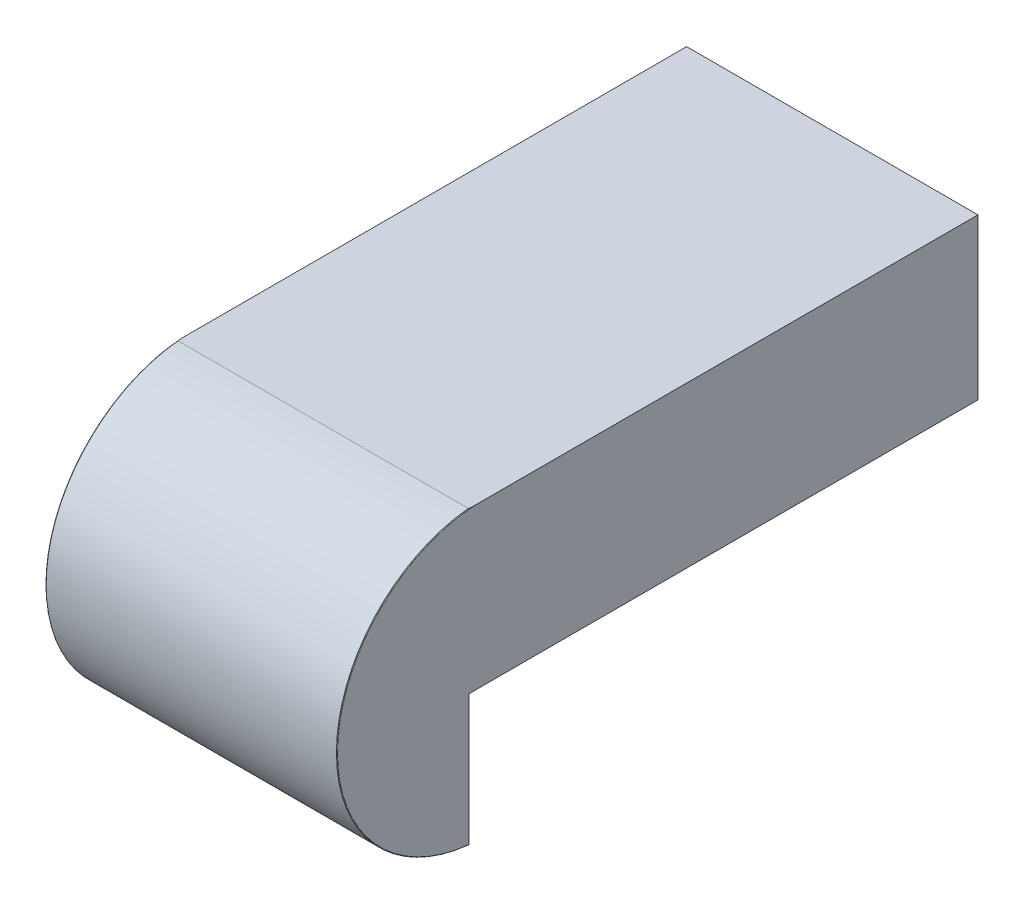
from build123d import *

# Parameters (mm, degrees)
SKETCH2_W           = 174.75062189439555
SKETCH2_H           = 55.00000000000001
BOSS_EXTRUDE1_DEPTH = 100
FILLET1_ANGLE       = 171.711787


with BuildPart() as part:
    # Sketch2 → Boss-Extrude1 (new body)
    with BuildSketch(Plane(origin=(0, 0, 0), x_dir=(0, 0, -1), z_dir=(1, 0, 0))):
        with Locations((87.37531094719778, 27.500000000000004)):
            Rectangle(SKETCH2_W, SKETCH2_H)
        with BuildLine():
            Line((0, 0), (0, 55.00000000000001))
            ThreePointArc((0, 55.00000000000001), (-45.24937810560445, 5.000000000000011), (5.51e-15, -45))
            Line((5.51e-15, -45), (0, 0))
        make_face()
    extrude(amount=BOSS_EXTRUDE1_DEPTH)

    # Fillet1: read off the stored shape, not the designer's step
    # Fillet1 outline → Fillet1 (revolve, cut)
    with BuildSketch(Plane(origin=(0, 5, -5), x_dir=(0, 0.998988212638407, 0.04497278076260073), z_dir=(0, 0.04497278076260073, -0.998988212638407))):
        with BuildLine():
            ThreePointArc((50.249378106, 0.1987375), (50.19116924, 0.058208866), (50.050640606, 0))
            Line((50.050640606, 0), (50.249378106, 0))
            Line((50.249378106, 0), (50.249378106, 0.1987375))
        make_face()
        with BuildLine():
            ThreePointArc((50.050640606, 100), (50.19116924, 99.941791134), (50.249378106, 99.8012625))
            Line((50.249378106, 99.8012625), (50.249378106, 100))
            Line((50.249378106, 100), (50.050640606, 100))
        make_face()
    revolve(axis=Axis((0, 5, -5), (1, 0, 0)), revolution_arc=FILLET1_ANGLE, mode=Mode.SUBTRACT)


solid = part.part
